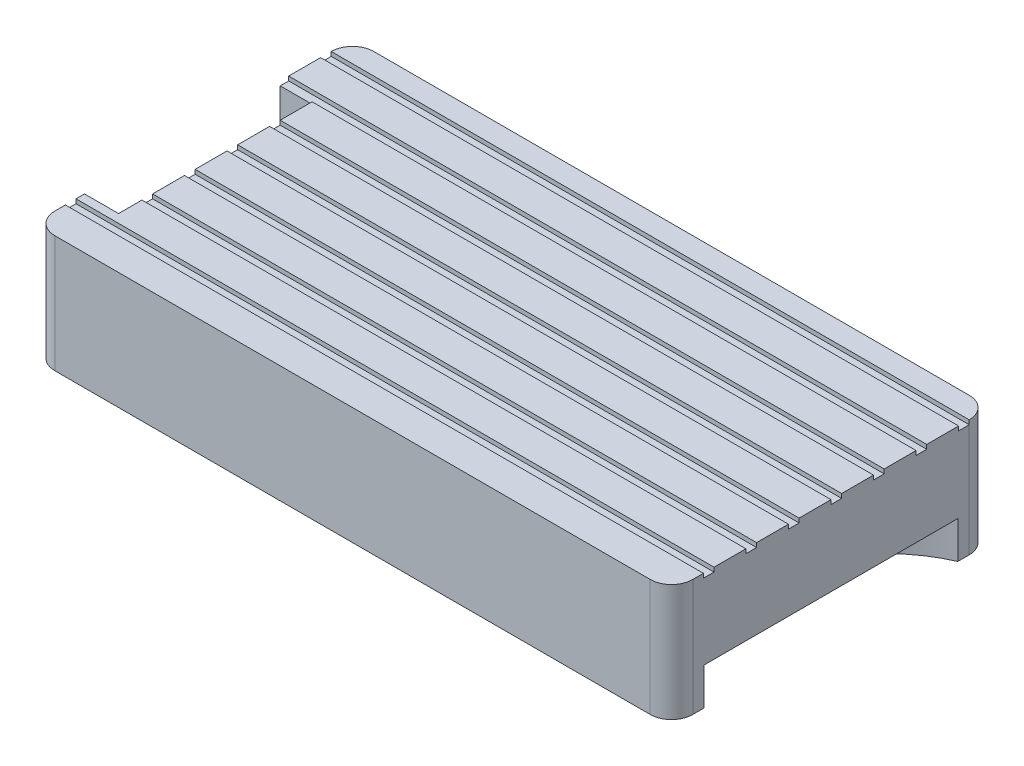
from build123d import *

# Parameters (mm, degrees)
SKETCH1_W               = 30
SKETCH1_H               = 15
BOSS_EXTRUDE1_DEPTH     = 5.5
CUT_EXTRUDE2_DEPTH      = 18.649362595
CUT_EXTRUDE2_DEPTH_BACK = 18.649362595
SKETCH2_W               = 0.5
SKETCH2_H               = 0.2
SKETCH5_W               = 9.2
SKETCH5_H               = 5.5
CUT_EXTRUDE4_DEPTH      = 1.6
SKETCH7_R               = 6.5
CUT_EXTRUDE6_DEPTH      = 1.75
FILLET1_R               = 1


with BuildPart() as part:
    # Sketch1 → Boss-Extrude1 (new body)
    with BuildSketch(Plane(origin=(0, 0, 0), x_dir=(1, 0, 0), z_dir=(0, 1, 0))):
        Rectangle(SKETCH1_W, SKETCH1_H)
    extrude(amount=BOSS_EXTRUDE1_DEPTH)

    # Sketch2 → Cut-Extrude2 (cut, two sides: drawn at the far end of the back side and taken through both)
    with BuildSketch(Plane(origin=(0, 0, 0), x_dir=(0, 0, -1), z_dir=(1, 0, 0)).offset(-CUT_EXTRUDE2_DEPTH_BACK)):
        with Locations((-5.75, 5.4)):
            Rectangle(SKETCH2_W, SKETCH2_H)
        with Locations((-3.75, 5.4)):
            Rectangle(SKETCH2_W, SKETCH2_H)
        with Locations((-1.75, 5.4)):
            Rectangle(SKETCH2_W, SKETCH2_H)
        with Locations((0.25, 5.4)):
            Rectangle(SKETCH2_W, SKETCH2_H)
        with Locations((2.25, 5.4)):
            Rectangle(SKETCH2_W, SKETCH2_H)
        with Locations((4.25, 5.4)):
            Rectangle(SKETCH2_W, SKETCH2_H)
        with Locations((6.25, 5.4)):
            Rectangle(SKETCH2_W, SKETCH2_H)
    extrude(amount=CUT_EXTRUDE2_DEPTH + CUT_EXTRUDE2_DEPTH_BACK, mode=Mode.SUBTRACT)

    # Sketch8 → Cut-Revolve1 (revolve, cut)
    with BuildSketch(Plane.XY.offset(4), mode=Mode.PRIVATE) as cut_revolve1_sk:
        Polygon((10.25, 0), (10.25, 3), (9, 3.721687836), (9, 0), align=None)
    cut_revolve1 = revolve(cut_revolve1_sk.sketch.rotate(Axis((9, 0, 4), (0, 1, 0)), 90), axis=Axis((9, 0, 4), (0, 1, 0)), mode=Mode.SUBTRACT)

    # Mirror1: Cut-Revolve1 across plane
    add(cut_revolve1.mirror(Plane.XY), mode=Mode.SUBTRACT)

    # Mirror2: Cut-Revolve1 across plane
    add(cut_revolve1.mirror(Plane(origin=(0, 0, 0), x_dir=(0, 0, 1), z_dir=(1, 0, 0))), mode=Mode.SUBTRACT)

    # Mirror2 copy 1 sketch → Mirror2 copy 1 (revolve, cut)
    with BuildSketch(Plane(origin=(0, 0, -4), x_dir=(-1, 0, 0), z_dir=(0, 0, -1))):
        Polygon((10.25, 0), (10.25, 3), (9, 3.721687836), (9, 0), align=None)
    revolve(axis=Axis((-9, 0, -4), (0, 1, 0)), mode=Mode.SUBTRACT)

    # Sketch5 → Cut-Extrude4 (cut)
    with BuildSketch(Plane(origin=(-15, 0, 0), x_dir=(0, 0, -1), z_dir=(1, 0, 0))):
        with Locations((-0.5, 2.75)):
            Rectangle(SKETCH5_W, SKETCH5_H)
    extrude(amount=CUT_EXTRUDE4_DEPTH, mode=Mode.SUBTRACT)

    # Sketch9 → Cut-Revolve2 (revolve, cut)
    with BuildSketch(Plane.XY):
        Polygon((-15, 2.5), (-7.678312164, 2.5), (-8.4, 3.75), (-15, 3.75), align=None)
    revolve(axis=Axis((-15, 2.5, 0), (-1, 0, 0)), mode=Mode.SUBTRACT)

    # Sketch7 → Cut-Extrude6 (cut)
    with BuildSketch(Plane.XZ):
        with Locations((17.59, 0)):
            Circle(SKETCH7_R)
    extrude(amount=-CUT_EXTRUDE6_DEPTH, mode=Mode.SUBTRACT)

    # Fillet1
    fillet1_edges = [part.edges().sort_by_distance(p)[0] for p in [
        (-15, 2.75, -7.5),
        (15, 2.75, -7.5),
        (15, 2.75, 7.5),
        (-15, 2.75, 7.5),
    ]]
    fillet(fillet1_edges, radius=FILLET1_R - 0.0001)  # a hair under: the kernel refuses the full size


solid = part.part
